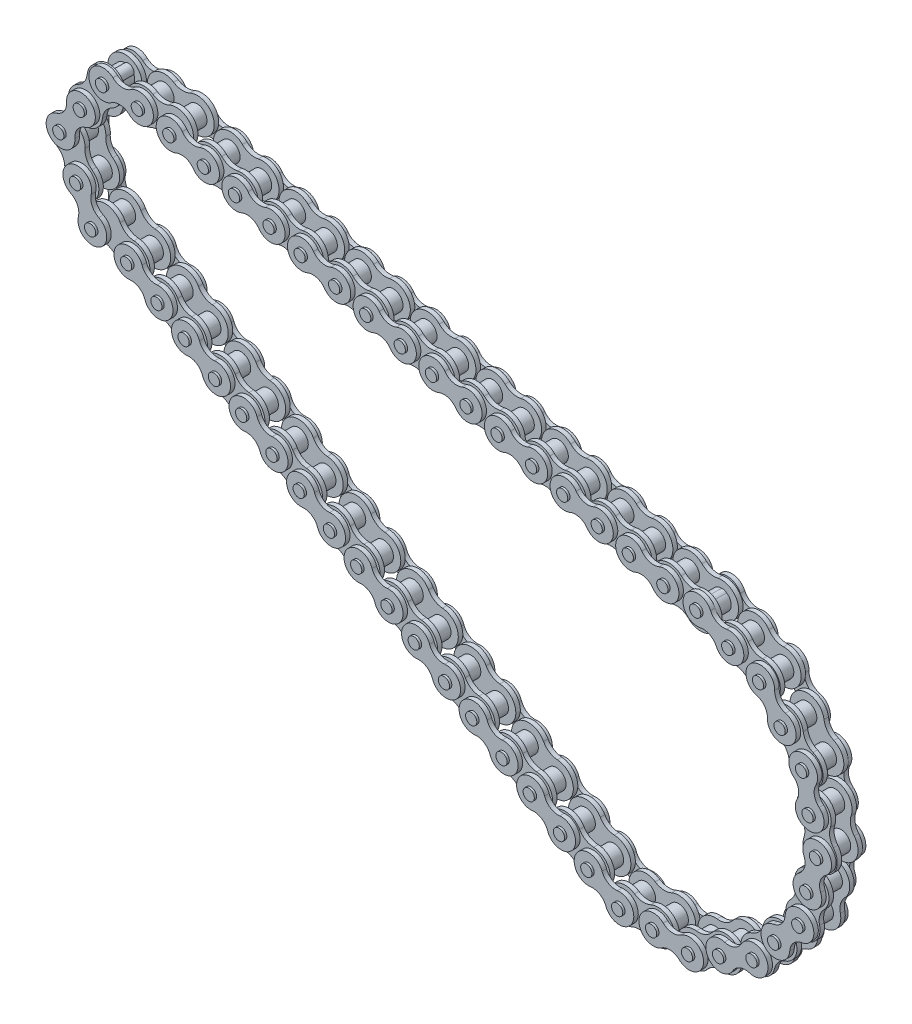
from build123d import *

# Parameters (mm, degrees)
SKETCH3_R            = 2.5908
SKETCH3_R_2          = 1.48844
EXTRUDE1_DEPTH       = 2.159
EXTRUDE2_DEPTH       = 1.190625
LPATTERN1_COUNT      = 2
LPATTERN1_PITCH      = 8.7249
EXTRUDE3_DEPTH       = 1.190625
SKETCH6_R            = 1.48844
EXTRUDE4_DEPTH       = 5.13842
CRVPATTERN1_ANGLE    = 32.4879736
CRVPATTERN1_2_ANGLE  = 91.9358413
CRVPATTERN1_3_ANGLE  = 151.3837091
CRVPATTERN1_4_ANGLE  = 163.4745468
CRVPATTERN1_5_ANGLE  = 163.4745468
CRVPATTERN1_6_ANGLE  = 163.4745468
CRVPATTERN1_7_ANGLE  = 163.4745468
CRVPATTERN1_8_ANGLE  = 163.4745468
CRVPATTERN1_9_ANGLE  = 163.4745468
CRVPATTERN1_10_ANGLE = 163.4745468
CRVPATTERN1_11_ANGLE = 163.4745468
CRVPATTERN1_12_ANGLE = 174.3108972
CRVPATTERN1_13_ANGLE = 159.4226716
CRVPATTERN1_14_ANGLE = 133.1562405
CRVPATTERN1_15_ANGLE = 106.8898094
CRVPATTERN1_16_ANGLE = 80.6233783
CRVPATTERN1_17_ANGLE = 54.3569472
CRVPATTERN1_18_ANGLE = 28.0905161
CRVPATTERN1_19_ANGLE = 1.824085


with BuildPart() as part:
    # Sketch3 → Extrude1 (new, symmetric)
    with BuildSketch(Plane.XY):
        with Locations((-9.432890247, -14.689523293)):
            Circle(SKETCH3_R)
        with Locations((-9.432890247, -14.689523293)):
            Circle(SKETCH3_R_2, mode=Mode.SUBTRACT)
    extrude1 = extrude(amount=EXTRUDE1_DEPTH, both=True)

    # Sketch4 → Extrude2 (add)
    with BuildSketch(Plane.XY.offset(2.159)):
        with BuildLine():
            ThreePointArc((-5.455664593, -12.53275598), (-13.239919691, -12.244836001), (-9.739295757, -19.203510976))
            ThreePointArc((-9.739295757, -19.203510976), (-7.601013976, -19.910469216), (-6.068475614, -21.560731347))
            ThreePointArc((-6.068475614, -21.560731347), (1.715779483, -21.848651326), (-1.78484445, -14.889976351))
            ThreePointArc((-1.78484445, -14.889976351), (-3.923126232, -14.183018111), (-5.455664593, -12.53275598))
        make_face()
    extrude2 = extrude(amount=EXTRUDE2_DEPTH)

    # LPattern1: Extrude1 ×2
    with Locations(*[Vector(0.8414486959116892, -0.5403370171925275, 0) * (i * LPATTERN1_PITCH) for i in range(1, LPATTERN1_COUNT)]):
        add(extrude1)

    # Sketch5 → Extrude3 (add)
    with BuildSketch(Plane.XY.offset(3.349625)):
        with BuildLine():
            ThreePointArc((5.526908871, -20.761376469), (3.071584838, -20.177998346), (1.519509457, -18.188021424))
            ThreePointArc((1.519509457, -18.188021424), (-5.297169492, -17.345279999), (-1.694609964, -23.193261688))
            ThreePointArc((-1.694609964, -23.193261688), (0.760714069, -23.776639811), (2.312789451, -25.766616733))
            ThreePointArc((2.312789451, -25.766616733), (9.129468399, -26.609358158), (5.526908871, -20.761376469))
        make_face()
    extrude3 = extrude(amount=EXTRUDE3_DEPTH)

    # Sketch6 → Extrude4 (add, symmetric)
    with BuildSketch(Plane.XY):
        with Locations((-2.091249961, -19.403964034)):
            Circle(SKETCH6_R)
        with Locations((5.923548868, -24.550674123)):
            Circle(SKETCH6_R)
    extrude(amount=EXTRUDE4_DEPTH, both=True)

    # Mirror1: Extrude2, Extrude3 across plane
    add(extrude2.mirror(Plane.XY))
    add(extrude3.mirror(Plane.XY))


with BuildPart() as body_2:
    # CrvPattern1: read off the stored shape, not the designer's step
    # CrvPattern1: copy of part
    add(part.part.moved(Location((-6.9119924, 4.438542, 0))).rotate(Axis((0, 0, 0), (0, 0, -1)), CRVPATTERN1_ANGLE))


with BuildPart() as body_3:
    # CrvPattern1 2: copy of part
    add(part.part.moved(Location((-6.9119924, 4.438542, 0))).rotate(Axis((0, 0, 0), (0, 0, -1)), CRVPATTERN1_2_ANGLE))


with BuildPart() as body_4:
    # CrvPattern1 3: copy of part
    add(part.part.moved(Location((-6.9119924, 4.438542, 0))).rotate(Axis((0, 0, 0), (0, 0, -1)), CRVPATTERN1_3_ANGLE))


with BuildPart() as body_5:
    # CrvPattern1 4: copy of part
    add(part.part.moved(Location((-19.0534137, 12.2351663, 0))).rotate(Axis((0, 0, 0), (0, 0, -1)), CRVPATTERN1_4_ANGLE))


with BuildPart() as body_6:
    # CrvPattern1 5: copy of part
    add(part.part.moved(Location((-34.2946905, 22.0223656, 0))).rotate(Axis((0, 0, 0), (0, 0, -1)), CRVPATTERN1_5_ANGLE))


with BuildPart() as body_7:
    # CrvPattern1 6: copy of part
    add(part.part.moved(Location((-49.5359674, 31.8095648, 0))).rotate(Axis((0, 0, 0), (0, 0, -1)), CRVPATTERN1_6_ANGLE))


with BuildPart() as body_8:
    # CrvPattern1 7: copy of part
    add(part.part.moved(Location((-64.7772442, 41.5967641, 0))).rotate(Axis((0, 0, 0), (0, 0, -1)), CRVPATTERN1_7_ANGLE))


with BuildPart() as body_9:
    # CrvPattern1 8: copy of part
    add(part.part.moved(Location((-80.0185211, 51.3839634, 0))).rotate(Axis((0, 0, 0), (0, 0, -1)), CRVPATTERN1_8_ANGLE))


with BuildPart() as body_10:
    # CrvPattern1 9: copy of part
    add(part.part.moved(Location((-95.2597979, 61.1711627, 0))).rotate(Axis((0, 0, 0), (0, 0, -1)), CRVPATTERN1_9_ANGLE))


with BuildPart() as body_11:
    # CrvPattern1 10: copy of part
    add(part.part.moved(Location((-110.5010748, 70.958362, 0))).rotate(Axis((0, 0, 0), (0, 0, -1)), CRVPATTERN1_10_ANGLE))


with BuildPart() as body_12:
    # CrvPattern1 11: copy of part
    add(part.part.moved(Location((-125.7423516, 80.7455612, 0))).rotate(Axis((0, 0, 0), (0, 0, -1)), CRVPATTERN1_11_ANGLE))


with BuildPart() as body_13:
    # CrvPattern1 12: copy of part
    add(part.part.moved(Location((-151.5453645, 62.9172684, 0))).rotate(Axis((0, 0, 0), (0, 0, -1)), CRVPATTERN1_12_ANGLE))


with BuildPart() as body_14:
    # CrvPattern1 13: copy of part
    add(part.part.moved(Location((-171.9335015, -3.7703859, 0))).rotate(Axis((0, 0, 0), (0, 0, 1)), CRVPATTERN1_13_ANGLE))


with BuildPart() as body_15:
    # CrvPattern1 14: copy of part
    add(part.part.moved(Location((-160.7041327, -72.5949503, 0))).rotate(Axis((0, 0, 0), (0, 0, 1)), CRVPATTERN1_14_ANGLE))


with BuildPart() as body_16:
    # CrvPattern1 15: copy of part
    add(part.part.moved(Location((-120.1762157, -129.343583, 0))).rotate(Axis((0, 0, 0), (0, 0, 1)), CRVPATTERN1_15_ANGLE))


with BuildPart() as body_17:
    # CrvPattern1 16: copy of part
    add(part.part.moved(Location((-58.7191004, -162.2972224, 0))).rotate(Axis((0, 0, 0), (0, 0, 1)), CRVPATTERN1_16_ANGLE))


with BuildPart() as body_18:
    # CrvPattern1 17: copy of part
    add(part.part.moved(Location((10.9758109, -164.6506694, 0))).rotate(Axis((0, 0, 0), (0, 0, 1)), CRVPATTERN1_17_ANGLE))


with BuildPart() as body_19:
    # CrvPattern1 18: copy of part
    add(part.part.moved(Location((74.5159428, -135.9179179, 0))).rotate(Axis((0, 0, 0), (0, 0, 1)), CRVPATTERN1_18_ANGLE))


with BuildPart() as body_20:
    # CrvPattern1 19: copy of part
    add(part.part.moved(Location((118.7797328, -82.0325184, 0))).rotate(Axis((0, 0, 0), (0, 0, 1)), CRVPATTERN1_19_ANGLE))


with BuildPart() as body_21:
    # CrvPattern1 20: copy of part
    add(part.part.moved(Location((106.688938, -68.510395, 0))))


with BuildPart() as body_22:
    # CrvPattern1 21: copy of part
    add(part.part.moved(Location((91.4476611, -58.7231957, 0))))


with BuildPart() as body_23:
    # CrvPattern1 22: copy of part
    add(part.part.moved(Location((76.2063843, -48.9359964, 0))))


with BuildPart() as body_24:
    # CrvPattern1 23: copy of part
    add(part.part.moved(Location((60.9651074, -39.1487971, 0))))


with BuildPart() as body_25:
    # CrvPattern1 24: copy of part
    add(part.part.moved(Location((45.7238306, -29.3615978, 0))))


with BuildPart() as body_26:
    # CrvPattern1 25: copy of part
    add(part.part.moved(Location((30.4825537, -19.5743986, 0))))


with BuildPart() as body_27:
    # CrvPattern1 26: copy of part
    add(part.part.moved(Location((15.2412769, -9.7871993, 0))))


solid = Compound([part.part, body_2.part, body_3.part, body_4.part, body_5.part, body_6.part, body_7.part, body_8.part, body_9.part, body_10.part, body_11.part, body_12.part, body_13.part, body_14.part, body_15.part, body_16.part, body_17.part, body_18.part, body_19.part, body_20.part, body_21.part, body_22.part, body_23.part, body_24.part, body_25.part, body_26.part, body_27.part])
